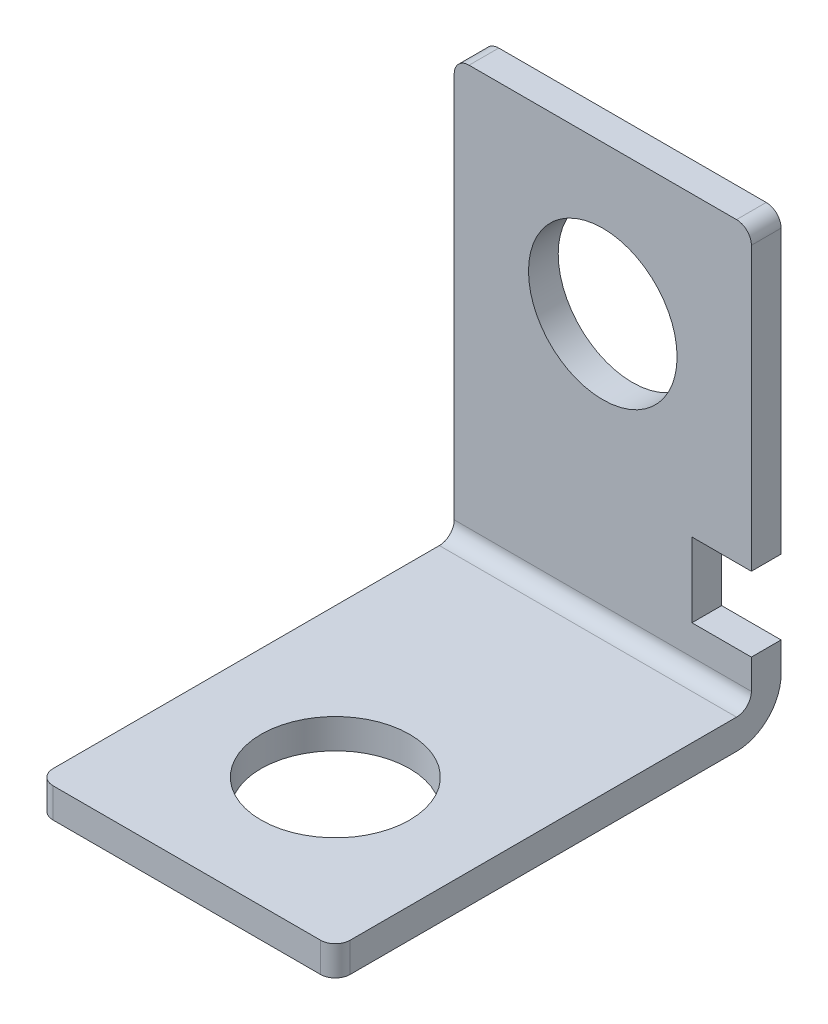
from build123d import *

# Parameters (mm, degrees)
SKETCH1_W           = 20
SKETCH1_H           = 30
SKETCH1_R           = 5
BOSS_EXTRUDE1_DEPTH = 2
SKETCH3_W           = 20
SKETCH3_H           = 30
BOSS_EXTRUDE2_DEPTH = 2
SKETCH3_3_R         = 5
CUT_EXTRUDE1_DEPTH  = 2
SKETCH5_W           = 4
SKETCH5_H           = 5
CUT_EXTRUDE2_DEPTH  = 2
FILLET1_R           = 1
FILLET2_R           = 1
FILLET3_R           = 3


with BuildPart() as part:
    # Sketch1 → Boss-Extrude1 (new body)
    with BuildSketch(Plane(origin=(0, 0, 0), x_dir=(1, 0, 0), z_dir=(0, 1, 0))):
        with Locations((10, 15)):
            Rectangle(SKETCH1_W, SKETCH1_H)
        with Locations((10, 10)):
            Circle(SKETCH1_R, mode=Mode.SUBTRACT)
    extrude(amount=BOSS_EXTRUDE1_DEPTH)

    # Sketch3 → Boss-Extrude2 (add)
    with BuildSketch(Plane(origin=(0, 0, -30), x_dir=(-1, 0, 0), z_dir=(0, 0, -1))):
        with Locations((-10, 15)):
            Rectangle(SKETCH3_W, SKETCH3_H)
    extrude(amount=-BOSS_EXTRUDE2_DEPTH)

    # Sketch3<3> → Cut-Extrude1 (cut)
    with BuildSketch(Plane(origin=(0, 0, -30), x_dir=(-1, 0, 0), z_dir=(0, 0, -1))):
        with Locations((-10, 20)):
            Circle(SKETCH3_3_R)
    extrude(amount=-CUT_EXTRUDE1_DEPTH, mode=Mode.SUBTRACT)

    # Sketch5 → Cut-Extrude2 (cut)
    with BuildSketch(Plane.XY.offset(-28)):
        with Locations((18, 7.5)):
            Rectangle(SKETCH5_W, SKETCH5_H)
    extrude(amount=-CUT_EXTRUDE2_DEPTH, mode=Mode.SUBTRACT)

    # Fillet1
    fillet1_edges = [part.edges().sort_by_distance(p)[0] for p in [
        (0, 30, -29),
        (20, 30, -29),
        (20, 1, 0),
        (0, 1, 0),
    ]]
    fillet(fillet1_edges, radius=FILLET1_R)

    # Fillet2
    fillet2_edges = [part.edges().sort_by_distance(p)[0] for p in [
        (10, 2, -28),
    ]]
    fillet(fillet2_edges, radius=FILLET2_R)

    # Fillet3
    fillet3_edges = [part.edges().sort_by_distance(p)[0] for p in [
        (10, 0, -30),
    ]]
    fillet(fillet3_edges, radius=FILLET3_R)


solid = part.part
